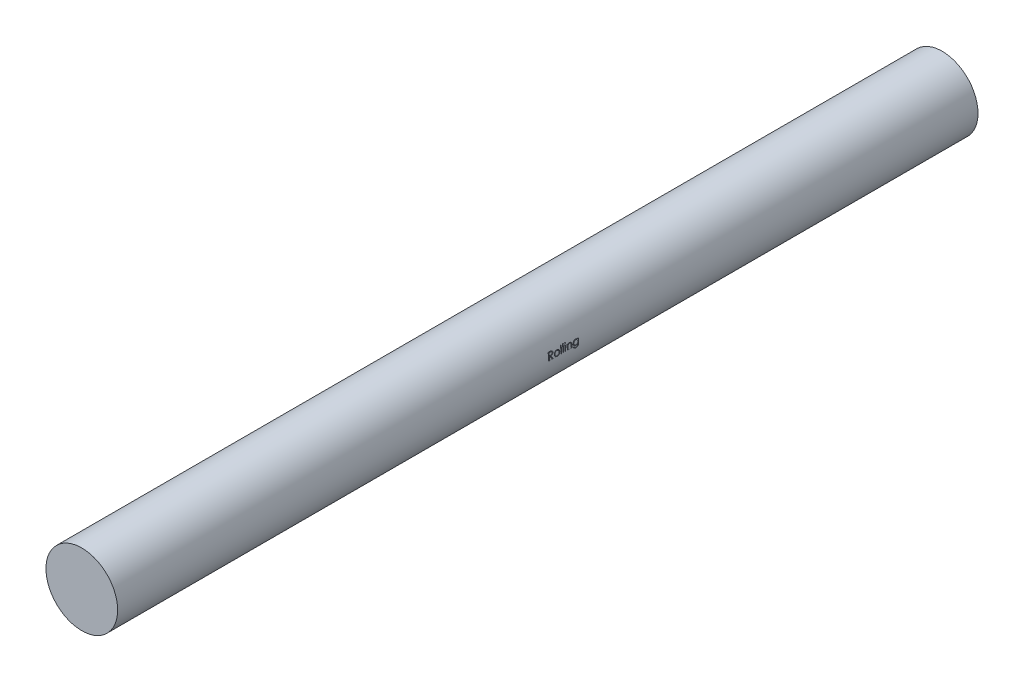
from build123d import *
from build123d.topology import SkipClean

# Parameters (mm, degrees)
SKETCH1_R               = 50
BOSS_EXTRUDE1_DEPTH     = 600
CUT_EXTRUDE1_DEPTH      = 605.15229868
CUT_EXTRUDE1_DEPTH_BACK = 605.15229868
SKETCH3_W               = 0.897435897
SKETCH3_H               = 10.256410256
SKETCH3_H_2             = 7.307692308


with BuildPart() as part:
    # Sketch1 → Boss-Extrude1 (new, symmetric)
    with BuildSketch(Plane.XY):
        Circle(SKETCH1_R)
    extrude(amount=BOSS_EXTRUDE1_DEPTH, both=True)

    # Sketch3 → Cut-Extrude1 (cut, two sides: drawn at the far end of the back side and taken through both)
    # profile 1 of 8: a face of its own
    with SkipClean():  # the faces are left unmerged after this step: merging them gives an invalid solid
        with BuildSketch(Plane(origin=(0, 0, 0), x_dir=(0, 0, -1), z_dir=(1, 0, 0)).offset(-CUT_EXTRUDE1_DEPTH_BACK)):
            with BuildLine():
                Line((1.282051282, 10), (3.283253205, 10))
                add(Edge.make_bspline(
                    [(3.283253205, 10), (3.416799287, 9.999555469), (3.673222556, 9.998701919), (4.040574757, 9.993942596), (4.374366463, 9.98030158), (4.674423147, 9.96856277), (4.940739304, 9.947157224), (5.174131563, 9.926698232), (5.373524985, 9.899916344), (5.494227417, 9.875043707), (5.548878205, 9.863782051)],
                    knots=[0, 0, 0, 0, 1.410062039, 2.707475311, 3.878576406, 4.937260626, 5.877586885, 6.699081471, 7.410979367, 8, 8, 8, 8], degree=3))
                add(Edge.make_bspline(
                    [(5.548878205, 9.863782051), (5.622039988, 9.845705579), (5.766802815, 9.809938254), (5.975231576, 9.734339395), (6.17384393, 9.646854753), (6.361814856, 9.544101266), (6.538202831, 9.425316181), (6.704826576, 9.292550117), (6.862442186, 9.146529529), (7.004675415, 8.983572839), (7.138786991, 8.812611383), (7.251897353, 8.627743506), (7.349401581, 8.434424856), (7.427031629, 8.230689377), (7.489540125, 8.018512886), (7.533615094, 7.795973467), (7.560047059, 7.564084967), (7.562738075, 7.405919513), (7.564102564, 7.325721154)],
                    knots=[0, 0, 0, 0, 1.027469482, 2.033020251, 3.019912614, 3.986113645, 4.951240523, 5.91722682, 6.890402269, 7.87763091, 8.8651537, 9.85103654, 10.82876324, 11.815024772, 12.821070561, 13.842952187, 14.906261191, 16, 16, 16, 16], degree=3))
                add(Edge.make_bspline(
                    [(7.564102564, 7.325721154), (7.559905427, 7.192477998), (7.551715724, 6.93248609), (7.475358285, 6.555169286), (7.350282515, 6.203199815), (7.17793026, 5.87702085), (6.958446044, 5.582990434), (6.694660927, 5.324731991), (6.386427751, 5.108617955), (6.099486848, 4.958752798), (5.846017706, 4.862773059), (5.637351098, 4.795240606), (5.409731163, 4.743063562), (5.165338778, 4.696320328), (4.903156905, 4.661029773), (4.623813935, 4.63518236), (4.327110645, 4.619027935), (4.123284733, 4.616622207), (4.018429487, 4.615384615)],
                    knots=[0, 0, 0, 0, 1.260483769, 2.459530307, 3.627416485, 4.787058657, 5.939039949, 7.08810263, 8.267026773, 9.491475466, 10.141966685, 10.831826277, 11.566392101, 12.351337768, 13.187381173, 14.07005841, 15.007169909, 16, 16, 16, 16], degree=3))
                Line((4.018429487, 4.615384615), (7.692307692, 0))
                Line((7.692307692, 0), (6.582532051, 0))
                Line((6.582532051, 0), (2.908653846, 4.615384615))
                Line((2.908653846, 4.615384615), (2.179487179, 4.615384615))
                Line((2.179487179, 4.615384615), (2.179487179, 0))
                Line((2.179487179, 0), (1.282051282, 0))
                Line((1.282051282, 0), (1.282051282, 10))
            make_face()
            with BuildLine():
                Line((2.179487179, 8.974358974), (2.179487179, 5.641025641))
                Line((2.179487179, 5.641025641), (4.010416667, 5.627003205))
                add(Edge.make_bspline(
                    [(4.010416667, 5.627003205), (4.095902492, 5.626965386), (4.26159837, 5.626892082), (4.501314555, 5.638302871), (4.724514874, 5.651283781), (4.930345594, 5.671139054), (5.118898667, 5.69672783), (5.290079847, 5.728736356), (5.444168567, 5.766027964), (5.623878677, 5.823746895), (5.824554481, 5.915192661), (6.042644366, 6.048236943), (6.228365331, 6.215577284), (6.385273509, 6.406930015), (6.511357599, 6.617319298), (6.600249183, 6.84422321), (6.656656161, 7.08191349), (6.663309148, 7.245279512), (6.666666667, 7.327724359)],
                    knots=[0, 0, 0, 0, 1.146690395, 2.22261258, 3.21895312, 4.145990853, 4.996080663, 5.770904154, 6.481378293, 7.121626537, 8.300444488, 9.431385265, 10.535395872, 11.636531494, 12.74115979, 13.810798291, 14.895190096, 16, 16, 16, 16], degree=3))
                add(Edge.make_bspline(
                    [(6.666666667, 7.327724359), (6.663232035, 7.408143141), (6.656425848, 7.567503823), (6.600857938, 7.800806424), (6.506888277, 8.02099771), (6.380253312, 8.227181953), (6.225970012, 8.414341198), (6.045061976, 8.574475921), (5.842475704, 8.706617249), (5.653129423, 8.791058336), (5.483888816, 8.842829345), (5.33694693, 8.879261242), (5.170914136, 8.908531153), (4.984984254, 8.931982755), (4.779951024, 8.952139739), (4.554777735, 8.96571625), (4.310958363, 8.973755861), (4.141967131, 8.974153258), (4.054487179, 8.974358974)],
                    knots=[0, 0, 0, 0, 1.101028733, 2.181837193, 3.264309656, 4.369019818, 5.486613113, 6.575447106, 7.666700264, 8.788928104, 9.402425223, 10.0903467, 10.862060571, 11.710948788, 12.657782767, 13.684531032, 14.801375019, 16, 16, 16, 16], degree=3))
                Line((4.054487179, 8.974358974), (2.179487179, 8.974358974))
            make_face(mode=Mode.SUBTRACT)
        # profile 2 of 8: a face of its own
        with BuildSketch(Plane(origin=(0, 0, 0), x_dir=(0, 0, -1), z_dir=(1, 0, 0)).offset(-CUT_EXTRUDE1_DEPTH_BACK)):
            with BuildLine():
                add(Edge.make_bspline(
                    [(13.016826923, 7.435897436), (13.153944845, 7.432977747), (13.422799581, 7.42725295), (13.816536398, 7.366067334), (14.192379644, 7.272503436), (14.551768764, 7.143156116), (14.890101037, 6.969779114), (15.212304592, 6.762895425), (15.517496045, 6.517802301), (15.700418986, 6.32820782), (15.793269231, 6.231971154)],
                    knots=[0, 0, 0, 0, 1.054011418, 2.066658804, 3.057071809, 4.030435133, 4.997543892, 5.974964718, 6.972108034, 8, 8, 8, 8], degree=3))
                add(Edge.make_bspline(
                    [(15.793269231, 6.231971154), (15.873217671, 6.139931194), (16.031567329, 5.957632502), (16.23461224, 5.662045037), (16.409530983, 5.355930464), (16.549710871, 5.035223816), (16.660239511, 4.702724756), (16.738712928, 4.357290438), (16.785389885, 3.999683732), (16.791684077, 3.756815623), (16.794871795, 3.633814103)],
                    knots=[0, 0, 0, 0, 1.025258237, 2.030674902, 3.01204498, 3.988269485, 4.97094183, 5.956517959, 6.965070386, 8, 8, 8, 8], degree=3))
                add(Edge.make_bspline(
                    [(16.794871795, 3.633814103), (16.792067974, 3.510099652), (16.786527493, 3.265634128), (16.734117161, 2.905578797), (16.652599772, 2.556450733), (16.535937378, 2.219711608), (16.38634278, 1.894332101), (16.203797958, 1.581733388), (15.987021909, 1.281298722), (15.741296204, 0.995579184), (15.469719415, 0.732247142), (15.175101848, 0.5027378), (14.863233181, 0.306104874), (14.529966457, 0.147715115), (14.178345066, 0.022830257), (13.807610586, -0.064884076), (13.418338956, -0.117917458), (13.152546895, -0.124727668), (13.016826923, -0.128205128)],
                    knots=[0, 0, 0, 0, 0.998656419, 1.973391657, 2.932242238, 3.890759089, 4.846373663, 5.82037756, 6.809684879, 7.83454468, 8.860553229, 9.859544525, 10.845671541, 11.83227036, 12.833544569, 13.85385346, 14.904124723, 16, 16, 16, 16], degree=3))
                add(Edge.make_bspline(
                    [(13.016826923, -0.128205128), (12.88044201, -0.124715996), (12.613325268, -0.117882355), (12.222679605, -0.065090118), (11.851280694, 0.022789832), (11.499198984, 0.148125525), (11.164499421, 0.306109936), (10.850823716, 0.502143335), (10.555966814, 0.732315207), (10.284332573, 0.995560741), (10.038622272, 1.281303474), (9.821842248, 1.581732155), (9.639298459, 1.894332422), (9.489703591, 2.219711522), (9.373041269, 2.556450756), (9.291523861, 2.905578791), (9.239113534, 3.26563413), (9.233573052, 3.510099653), (9.230769231, 3.633814103)],
                    knots=[0, 0, 0, 0, 1.099876186, 2.154163076, 3.173186993, 4.173200201, 5.163417411, 6.152872554, 7.150605724, 8.17532212, 9.198891216, 10.186952605, 11.159729845, 12.11414092, 13.071450619, 14.029093627, 15.002601286, 16, 16, 16, 16], degree=3))
                add(Edge.make_bspline(
                    [(9.230769231, 3.633814103), (9.233978689, 3.756147091), (9.240332864, 3.998345383), (9.28696289, 4.355279842), (9.365130195, 4.700129525), (9.475791327, 5.031345171), (9.617263301, 5.350646417), (9.789724124, 5.657517363), (9.994840217, 5.951768221), (10.152560079, 6.133831307), (10.232371795, 6.225961538)],
                    knots=[0, 0, 0, 0, 1.031353054, 2.041901799, 3.029428768, 4.008703097, 4.981709435, 5.96992636, 6.972712378, 8, 8, 8, 8], degree=3))
                add(Edge.make_bspline(
                    [(10.232371795, 6.225961538), (10.325082055, 6.323032793), (10.507413095, 6.513940497), (10.814123745, 6.758319137), (11.135534663, 6.96950792), (11.47760588, 7.139439964), (11.83669976, 7.2732643), (12.214469024, 7.366308629), (12.609541926, 7.4270325), (12.879712272, 7.432913008), (13.016826923, 7.435897436)],
                    knots=[0, 0, 0, 0, 1.027980169, 2.021703884, 2.998553061, 3.971491411, 4.943284454, 5.930300938, 6.949603206, 8, 8, 8, 8], degree=3))
            make_face()
            with BuildLine():
                add(Edge.make_bspline(
                    [(13.012820513, 6.538461538), (12.915855909, 6.535705562), (12.724429827, 6.530264755), (12.442659585, 6.48888217), (12.171402002, 6.423317873), (11.910142448, 6.330163426), (11.659761955, 6.209880858), (11.420020805, 6.062142686), (11.190213834, 5.888905667), (10.97483651, 5.690440891), (10.777172761, 5.473643764), (10.604378543, 5.242648453), (10.457449667, 5.001201749), (10.335049213, 4.749052575), (10.243885818, 4.483645678), (10.177677183, 4.207986731), (10.136333639, 3.921514113), (10.130943986, 3.726768346), (10.128205128, 3.627804487)],
                    knots=[0, 0, 0, 0, 1.021534396, 2.016698045, 2.994645724, 3.958388632, 4.93408049, 5.916473867, 6.921342795, 7.962252576, 8.998418191, 10.008913653, 10.997312074, 11.973003931, 12.956656626, 13.948281152, 14.957379055, 16, 16, 16, 16], degree=3))
                add(Edge.make_bspline(
                    [(10.128205128, 3.627804487), (10.132796053, 3.499941552), (10.14190818, 3.246157537), (10.216008855, 2.872411472), (10.339969655, 2.51360618), (10.507361883, 2.171845077), (10.717093936, 1.855638569), (10.964199841, 1.573720042), (11.246027556, 1.330332009), (11.559217557, 1.128386736), (11.897372751, 0.967930291), (12.255247954, 0.854218932), (12.62850708, 0.780299811), (12.883594883, 0.772952741), (13.012820513, 0.769230769)],
                    knots=[0, 0, 0, 0, 1.016792936, 2.018143844, 3.017858371, 4.030088057, 5.03801393, 6.028138512, 7.003788237, 7.991172063, 8.984598303, 9.972568034, 10.972917682, 12, 12, 12, 12], degree=3))
                add(Edge.make_bspline(
                    [(13.012820513, 0.769230769), (13.14203871, 0.772974427), (13.397111841, 0.780364304), (13.769852346, 0.853846646), (14.126749409, 0.968428534), (14.464553373, 1.128206276), (14.777600812, 1.33109889), (15.061455444, 1.572345681), (15.306451476, 1.856385257), (15.515976061, 2.17226391), (15.686109612, 2.513076345), (15.809490188, 2.872477694), (15.883769005, 3.246140671), (15.892857087, 3.499935902), (15.897435897, 3.627804487)],
                    knots=[0, 0, 0, 0, 1.02726834, 2.027799167, 3.010890988, 4.004497153, 4.992059811, 5.971914811, 6.958719428, 7.966827853, 8.981595046, 9.981490638, 10.983022906, 12, 12, 12, 12], degree=3))
                add(Edge.make_bspline(
                    [(15.897435897, 3.627804487), (15.894697983, 3.726768938), (15.889310186, 3.921515868), (15.847953145, 4.207980021), (15.78179446, 4.483670297), (15.690446982, 4.748961735), (15.568578371, 5.001854605), (15.418816105, 5.241939539), (15.246727461, 5.474443957), (15.046678544, 5.689740073), (14.831526036, 5.888983035), (14.601625927, 6.062209862), (14.362240274, 6.209231563), (14.11258718, 6.33119225), (13.85129413, 6.422470366), (13.580416618, 6.489260741), (13.29984859, 6.530089875), (13.109108466, 6.535653136), (13.012820513, 6.538461538)],
                    knots=[0, 0, 0, 0, 1.042956736, 2.052379634, 3.044323526, 4.02829302, 5.004299113, 5.996692471, 7.007513377, 8.048758398, 9.090003419, 10.095195979, 11.07790575, 12.047570684, 13.018257071, 13.989683339, 14.985167495, 16, 16, 16, 16], degree=3))
            make_face(mode=Mode.SUBTRACT)
        # profile 3 of 8: a face of its own
        with BuildSketch(Plane(origin=(0, 0, 0), x_dir=(0, 0, -1), z_dir=(1, 0, 0)).offset(-CUT_EXTRUDE1_DEPTH_BACK)):
            with Locations((18.910256411, 5.128205128)):
                Rectangle(SKETCH3_W, SKETCH3_H)
        # profile 4 of 8: a face of its own
        with BuildSketch(Plane(origin=(0, 0, 0), x_dir=(0, 0, -1), z_dir=(1, 0, 0)).offset(-CUT_EXTRUDE1_DEPTH_BACK)):
            with Locations((21.730769231, 5.128205128)):
                Rectangle(SKETCH3_W, SKETCH3_H)
        # profile 5 of 8: a face of its own
        with BuildSketch(Plane(origin=(0, 0, 0), x_dir=(0, 0, -1), z_dir=(1, 0, 0)).offset(-CUT_EXTRUDE1_DEPTH_BACK)):
            with BuildLine():
                add(Edge.make_bspline(
                    [(24.547275641, 10.384615385), (24.602965115, 10.382032092), (24.7120158, 10.376973509), (24.86971085, 10.333655003), (25.013302314, 10.26022733), (25.140667265, 10.161713956), (25.249958369, 10.045858404), (25.326474685, 9.910827066), (25.375652959, 9.764945241), (25.381591689, 9.663187843), (25.384615385, 9.611378205)],
                    knots=[0, 0, 0, 0, 1.055194115, 2.066272739, 3.074728998, 4.095836921, 5.109056067, 6.073838105, 7.019297344, 8, 8, 8, 8], degree=3))
                add(Edge.make_bspline(
                    [(25.384615385, 9.611378205), (25.381523499, 9.560913482), (25.375411208, 9.461150696), (25.32651267, 9.317797919), (25.249306277, 9.184642823), (25.140737346, 9.069012222), (25.013283743, 8.970553308), (24.869715784, 8.897111197), (24.712014502, 8.853796519), (24.602964676, 8.848737408), (24.547275641, 8.846153846)],
                    knots=[0, 0, 0, 0, 0.96129708, 1.900370562, 2.859976407, 3.87933698, 4.906634145, 5.921202961, 6.938410037, 8, 8, 8, 8], degree=3))
                add(Edge.make_bspline(
                    [(24.547275641, 8.846153846), (24.492223426, 8.848638761), (24.385071483, 8.853475323), (24.229737648, 8.897961088), (24.087370535, 8.97057844), (23.959757185, 9.06836754), (23.853385204, 9.185352961), (23.775961417, 9.317716658), (23.727175812, 9.461171385), (23.721048302, 9.560920432), (23.717948718, 9.611378205)],
                    knots=[0, 0, 0, 0, 1.054934014, 2.053291228, 3.073705704, 4.106921865, 5.123545215, 6.088680038, 7.033164197, 8, 8, 8, 8], degree=3))
                add(Edge.make_bspline(
                    [(23.717948718, 9.611378205), (23.720980394, 9.663180633), (23.726934797, 9.764923869), (23.775997986, 9.910909677), (23.852740294, 10.045142539), (23.959827618, 10.162358252), (24.08735179, 10.260202351), (24.229742491, 10.332805156), (24.385070203, 10.377294697), (24.492222992, 10.382130738), (24.547275641, 10.384615385)],
                    knots=[0, 0, 0, 0, 0.98631895, 1.937192651, 2.907499808, 3.917963147, 4.944918757, 5.95915025, 6.951458133, 8, 8, 8, 8], degree=3))
            make_face()
        # profile 6 of 8: a face of its own
        with BuildSketch(Plane(origin=(0, 0, 0), x_dir=(0, 0, -1), z_dir=(1, 0, 0)).offset(-CUT_EXTRUDE1_DEPTH_BACK)):
            with Locations((24.551282052, 3.653846154)):
                Rectangle(SKETCH3_W, SKETCH3_H_2)
        # profile 7 of 8: a face of its own
        with BuildSketch(Plane(origin=(0, 0, 0), x_dir=(0, 0, -1), z_dir=(1, 0, 0)).offset(-CUT_EXTRUDE1_DEPTH_BACK)):
            with BuildLine():
                Line((27.179487179, 7.307692308), (28.076923077, 7.307692308))
                Line((28.076923077, 7.307692308), (28.076923077, 5.989583333))
                add(Edge.make_bspline(
                    [(28.076923077, 5.989583333), (28.172744892, 6.10913397), (28.358690466, 6.341126151), (28.66835999, 6.646042079), (28.995628276, 6.89731415), (29.338491143, 7.097610704), (29.697414029, 7.248601065), (30.070209086, 7.357646582), (30.459108247, 7.423031807), (30.723578066, 7.431575322), (30.857371795, 7.435897436)],
                    knots=[0, 0, 0, 0, 1.12780773, 2.188550248, 3.19190651, 4.159438251, 5.104880172, 6.052711206, 7.014878035, 8, 8, 8, 8], degree=3))
                add(Edge.make_bspline(
                    [(30.857371795, 7.435897436), (30.992602178, 7.430911163), (31.257280657, 7.421151825), (31.642646547, 7.343961279), (32.002570529, 7.212117693), (32.33576926, 7.031511777), (32.636132727, 6.806921853), (32.899918017, 6.545271048), (33.118098723, 6.24431081), (33.264376903, 5.965101793), (33.360735897, 5.717419523), (33.421399718, 5.505285952), (33.472916808, 5.268948377), (33.517578945, 5.009120979), (33.547799265, 4.723983293), (33.571634384, 4.414704173), (33.588716367, 4.0813838), (33.589394101, 3.850850579), (33.58974359, 3.731971154)],
                    knots=[0, 0, 0, 0, 1.235846778, 2.418850247, 3.575807741, 4.728682307, 5.871620074, 6.994088408, 8.11269785, 9.256955736, 9.865816715, 10.540099792, 11.271859618, 12.076849838, 12.949306005, 13.892391288, 14.913166135, 16, 16, 16, 16], degree=3))
                Line((33.58974359, 3.731971154), (33.58974359, 0))
                Line((33.58974359, 0), (32.692307692, 0))
                Line((32.692307692, 0), (32.692307692, 3.4375))
                add(Edge.make_bspline(
                    [(32.692307692, 3.4375), (32.691755669, 3.5369927), (32.690699744, 3.727305302), (32.687369324, 3.999788225), (32.679341306, 4.246892735), (32.668060412, 4.468028071), (32.651548896, 4.662981889), (32.634341378, 4.832151251), (32.613298587, 4.975321373), (32.594547406, 5.061507322), (32.586137821, 5.100160256)],
                    knots=[0, 0, 0, 0, 1.430800155, 2.736877192, 3.918605307, 4.986035426, 5.920637409, 6.731861385, 7.431261377, 8, 8, 8, 8], degree=3))
                add(Edge.make_bspline(
                    [(32.586137821, 5.100160256), (32.555779159, 5.213620785), (32.497348129, 5.431997198), (32.35296532, 5.728209634), (32.170639089, 5.980204456), (31.948073805, 6.186423661), (31.687419303, 6.346911766), (31.389398895, 6.458265922), (31.056888493, 6.527912406), (30.823018828, 6.534847069), (30.701121795, 6.538461538)],
                    knots=[0, 0, 0, 0, 1.084156227, 2.086665306, 3.027808233, 3.945421172, 4.874247719, 5.839848303, 6.874090471, 8, 8, 8, 8], degree=3))
                add(Edge.make_bspline(
                    [(30.701121795, 6.538461538), (30.628928413, 6.537101525), (30.486059576, 6.534410094), (30.274202513, 6.507406385), (30.068704876, 6.463239369), (29.867504279, 6.403614691), (29.674624868, 6.321722493), (29.48386975, 6.228781435), (29.302421853, 6.112929401), (29.126412147, 5.98381334), (28.962661268, 5.840729891), (28.810294587, 5.689745576), (28.674471672, 5.528958136), (28.551418314, 5.360958286), (28.445194704, 5.183438749), (28.352471595, 4.998112159), (28.273798181, 4.804734591), (28.234704774, 4.67052013), (28.215144231, 4.603365385)],
                    knots=[0, 0, 0, 0, 1.023777757, 2.026029729, 3.023749952, 4.003683103, 4.997618607, 5.993177895, 7.010360494, 8.046726602, 9.087585522, 10.09234134, 11.086953743, 12.070360549, 13.043493632, 14.017870808, 15.008233677, 16, 16, 16, 16], degree=3))
                add(Edge.make_bspline(
                    [(28.215144231, 4.603365385), (28.203888092, 4.554064804), (28.179384067, 4.44674002), (28.152917838, 4.270613108), (28.128896194, 4.066870322), (28.108790598, 3.835749416), (28.096489409, 3.576441202), (28.083076846, 3.290053094), (28.078193815, 2.975443127), (28.077358518, 2.756409719), (28.076923077, 2.642227564)],
                    knots=[0, 0, 0, 0, 0.615963638, 1.340920617, 2.168419149, 3.115676021, 4.16674242, 5.331190069, 6.6087489, 8, 8, 8, 8], degree=3))
                Line((28.076923077, 2.642227564), (28.076923077, 0))
                Line((28.076923077, 0), (27.179487179, 0))
                Line((27.179487179, 0), (27.179487179, 7.307692308))
            make_face()
        # profile 8 of 8: a face of its own
        with BuildSketch(Plane(origin=(0, 0, 0), x_dir=(0, 0, -1), z_dir=(1, 0, 0)).offset(-CUT_EXTRUDE1_DEPTH_BACK)):
            with BuildLine():
                Line((42.051282051, 7.307692308), (42.948717949, 7.307692308))
                Line((42.948717949, 7.307692308), (42.948717949, 1.508413462))
                add(Edge.make_bspline(
                    [(42.948717949, 1.508413462), (42.947926399, 1.384877477), (42.946398516, 1.146423269), (42.935395741, 0.801628185), (42.912193806, 0.483153655), (42.885883288, 0.189547201), (42.848035527, -0.077830256), (42.801817335, -0.319776555), (42.749715394, -0.536523876), (42.703943345, -0.670023422), (42.682291667, -0.733173077)],
                    knots=[0, 0, 0, 0, 1.307562039, 2.523909702, 3.650326591, 4.686913197, 5.643429486, 6.506965704, 7.293745905, 8, 8, 8, 8], degree=3))
                add(Edge.make_bspline(
                    [(42.682291667, -0.733173077), (42.650322413, -0.815258567), (42.587339766, -0.976975244), (42.469380813, -1.206216161), (42.337283946, -1.422062989), (42.186407516, -1.62331285), (42.01743379, -1.808955457), (41.834343812, -1.983024026), (41.633571837, -2.141835933), (41.415232659, -2.282651069), (41.184359421, -2.409471223), (40.941084844, -2.519318558), (40.686780734, -2.614995254), (40.419058187, -2.686660385), (40.14211466, -2.748759586), (39.852693428, -2.789172974), (39.552485437, -2.816678855), (39.34835578, -2.819222378), (39.244791667, -2.820512821)],
                    knots=[0, 0, 0, 0, 0.981931301, 1.934503488, 2.87077864, 3.801706999, 4.735015492, 5.667491629, 6.616593066, 7.585388521, 8.561939025, 9.551802639, 10.560317337, 11.588439944, 12.640189604, 13.723962949, 14.845264515, 16, 16, 16, 16], degree=3))
                add(Edge.make_bspline(
                    [(39.244791667, -2.820512821), (39.093692425, -2.818065718), (38.79855501, -2.81328587), (38.368255031, -2.757597541), (37.959584403, -2.678870761), (37.577943098, -2.559712396), (37.225742821, -2.413892426), (36.905388891, -2.246478274), (36.619757155, -2.054508821), (36.362260946, -1.835935675), (36.129856403, -1.576039442), (35.911207003, -1.26975703), (35.700747169, -0.912423061), (35.577408204, -0.650158166), (35.512820513, -0.512820513)],
                    knots=[0, 0, 0, 0, 1.157897085, 2.2616841, 3.32207898, 4.345638746, 5.321241055, 6.241986252, 7.112515963, 7.955008012, 8.825025602, 9.77857164, 10.836726669, 12, 12, 12, 12], degree=3))
                Line((35.512820513, -0.512820513), (36.41025641, -0.512820513))
                add(Edge.make_bspline(
                    [(36.41025641, -0.512820513), (36.482434151, -0.627408729), (36.623532747, -0.851414582), (36.887385549, -1.141452171), (37.176546482, -1.389318927), (37.500774148, -1.589063996), (37.861417621, -1.7396634), (38.258693867, -1.847021389), (38.695835643, -1.911296438), (39.000173398, -1.919042992), (39.158653846, -1.923076923)],
                    knots=[0, 0, 0, 0, 0.997731894, 1.950442991, 2.880492273, 3.800895997, 4.748200782, 5.754801363, 6.83083817, 8, 8, 8, 8], degree=3))
                add(Edge.make_bspline(
                    [(39.158653846, -1.923076923), (39.315130676, -1.918990784), (39.61680234, -1.911113116), (40.050605681, -1.846992704), (40.446591218, -1.739640036), (40.802477505, -1.589330361), (41.114065416, -1.405186342), (41.382671105, -1.199471844), (41.600227322, -0.967526121), (41.746550084, -0.753863818), (41.837506135, -0.563509162), (41.895426811, -0.399644602), (41.942495295, -0.214350666), (41.98186626, -0.008248562), (42.014354584, 0.218956172), (42.034934247, 0.467783039), (42.049807995, 0.737666531), (42.050779337, 0.924789783), (42.051282051, 1.021634615)],
                    knots=[0, 0, 0, 0, 1.570740765, 3.028230971, 4.391408896, 5.680370741, 6.894727393, 8.017376726, 9.065722033, 10.075533815, 10.603371122, 11.180248986, 11.817768598, 12.521299649, 13.286540596, 14.121245857, 15.027658897, 16, 16, 16, 16], degree=3))
                Line((42.051282051, 1.021634615), (42.051282051, 1.400240385))
                add(Edge.make_bspline(
                    [(42.051282051, 1.400240385), (41.960193144, 1.291835236), (41.779617557, 1.076931751), (41.467768051, 0.795327075), (41.127148292, 0.552795274), (40.75833817, 0.353884889), (40.370371764, 0.194795105), (39.967451106, 0.083529502), (39.553188091, 0.011644074), (39.272467663, 0.003908885), (39.130608974, 0)],
                    knots=[0, 0, 0, 0, 1.012485704, 2.007162095, 2.997754123, 3.998611389, 4.999708251, 5.992315798, 6.98544096, 8, 8, 8, 8], degree=3))
                add(Edge.make_bspline(
                    [(39.130608974, 0), (39.047076776, 0.001471504), (38.881000897, 0.004397099), (38.634273048, 0.029993606), (38.391186081, 0.067132869), (38.152306928, 0.121651267), (37.917290891, 0.191627628), (37.686526342, 0.279104025), (37.458144837, 0.378004362), (37.236297701, 0.494498087), (37.02319447, 0.624104678), (36.820442512, 0.764501508), (36.629103829, 0.91495376), (36.450999574, 1.076945017), (36.28636337, 1.250240825), (36.13298089, 1.432993833), (35.993388469, 1.627755952), (35.864721643, 1.83097583), (35.753128642, 2.044007041), (35.655173294, 2.262230171), (35.570003565, 2.485178612), (35.502102417, 2.713598791), (35.450242094, 2.947346702), (35.411641445, 3.186039413), (35.389747355, 3.43041195), (35.386333286, 3.595044376), (35.384615385, 3.677884615)],
                    knots=[0, 0, 0, 0, 1.028754217, 2.045334182, 3.052854819, 4.056607503, 5.061168794, 6.071104265, 7.095078842, 8.125279047, 9.155117945, 10.165957491, 11.161587969, 12.151493252, 13.128948131, 14.104219989, 15.088194871, 16.07871515, 17.064853787, 18.047899887, 19.02414258, 20.002704429, 20.980574569, 21.971845993, 22.979467364, 24, 24, 24, 24], degree=3))
                add(Edge.make_bspline(
                    [(35.384615385, 3.677884615), (35.386098717, 3.760750604), (35.389059636, 3.926161629), (35.414633863, 4.171531302), (35.451114404, 4.413615402), (35.508850887, 4.649918664), (35.578343808, 4.883132241), (35.664411159, 5.111533545), (35.767893328, 5.335192142), (35.885064041, 5.554273661), (36.016732878, 5.765838275), (36.161111394, 5.966771549), (36.318373892, 6.155594897), (36.486350794, 6.334213245), (36.667093128, 6.500903226), (36.860507392, 6.655260268), (37.06468705, 6.799871772), (37.280264907, 6.93161845), (37.503914588, 7.048139154), (37.729954068, 7.15446086), (37.961377597, 7.238844058), (38.193870566, 7.31319577), (38.431527466, 7.365867756), (38.671434305, 7.406502733), (38.914412412, 7.431259079), (39.07713497, 7.434349322), (39.158653846, 7.435897436)],
                    knots=[0, 0, 0, 0, 1.008818848, 2.013730394, 3.001654427, 3.987803273, 4.973046549, 5.963777569, 6.957074694, 7.972068341, 8.987420212, 9.989399531, 10.982630087, 11.977756091, 12.973280677, 13.973972381, 14.989194003, 16.018387222, 17.047741039, 18.059210846, 19.057554164, 20.045176975, 21.029480261, 22.018708529, 23.007435371, 24, 24, 24, 24], degree=3))
                add(Edge.make_bspline(
                    [(39.158653846, 7.435897436), (39.2930851, 7.432021227), (39.558545521, 7.424366904), (39.949205528, 7.364306489), (40.326183357, 7.268552165), (40.691606259, 7.131364649), (41.048450976, 6.944078825), (41.39554142, 6.697384688), (41.733881803, 6.389069432), (41.942675604, 6.152632676), (42.051282051, 6.029647436)],
                    knots=[0, 0, 0, 0, 0.96728863, 1.910097829, 2.838038873, 3.762875196, 4.71315279, 5.730631239, 6.819562287, 8, 8, 8, 8], degree=3))
                Line((42.051282051, 6.029647436), (42.051282051, 7.307692308))
            make_face()
            with BuildLine():
                add(Edge.make_bspline(
                    [(39.230769231, 6.538461538), (39.099538648, 6.534001351), (38.839729921, 6.525171127), (38.458906086, 6.449786232), (38.091257704, 6.331655089), (37.743813624, 6.162676188), (37.418364738, 5.956692651), (37.129579537, 5.707148972), (36.876994063, 5.422159838), (36.663328525, 5.104301989), (36.493238906, 4.761381202), (36.372829136, 4.399921962), (36.294971927, 4.02576484), (36.286378635, 3.770414545), (36.282051282, 3.641826923)],
                    knots=[0, 0, 0, 0, 1.026226791, 2.031711442, 3.026614839, 4.04107745, 5.047145931, 6.032893242, 7.017642609, 8.019221815, 9.021877557, 10.003543541, 10.994637589, 12, 12, 12, 12], degree=3))
                add(Edge.make_bspline(
                    [(36.282051282, 3.641826923), (36.284124873, 3.544874716), (36.28820302, 3.354198076), (36.327413242, 3.074375519), (36.390787428, 2.807860338), (36.480608018, 2.554636411), (36.591901432, 2.313251282), (36.731879634, 2.085367755), (36.896596696, 1.87078288), (37.084763376, 1.671083789), (37.292124467, 1.489195308), (37.517036465, 1.329372335), (37.759194322, 1.198655989), (38.012642351, 1.085682168), (38.283530225, 1.003170545), (38.567956185, 0.940202605), (38.867932461, 0.904177583), (39.072423145, 0.899712447), (39.176682692, 0.897435897)],
                    knots=[0, 0, 0, 0, 1.039728707, 2.044842319, 3.024901384, 3.974314358, 4.923051295, 5.871625912, 6.837440708, 7.820715446, 8.810779094, 9.792721783, 10.773906224, 11.758876063, 12.764959493, 13.806266761, 14.881525401, 16, 16, 16, 16], degree=3))
                add(Edge.make_bspline(
                    [(39.176682692, 0.897435897), (39.28229343, 0.899629066), (39.488814108, 0.903917784), (39.790445355, 0.940784923), (40.076253185, 1.000276284), (40.345975535, 1.08474207), (40.600630795, 1.192518501), (40.837358265, 1.328908837), (41.061233831, 1.484235785), (41.265109287, 1.665412969), (41.449464046, 1.865084383), (41.61012338, 2.082355512), (41.747021805, 2.313956995), (41.860386576, 2.559862725), (41.946932874, 2.821983734), (42.004986888, 3.09966475), (42.045577589, 3.391575433), (42.049351659, 3.59160005), (42.051282051, 3.693910256)],
                    knots=[0, 0, 0, 0, 1.121943988, 2.193949579, 3.223793937, 4.220241907, 5.192961521, 6.155822191, 7.11847367, 8.083710714, 9.04790392, 10.001595906, 10.949595423, 11.902125208, 12.873731292, 13.87582262, 14.913508608, 16, 16, 16, 16], degree=3))
                add(Edge.make_bspline(
                    [(42.051282051, 3.693910256), (42.047454714, 3.827104125), (42.039977441, 4.087318139), (41.969414133, 4.466480333), (41.855642104, 4.822962258), (41.696079955, 5.155636475), (41.496131359, 5.460978046), (41.255300362, 5.733331887), (40.977740274, 5.97304862), (40.66424856, 6.172757745), (40.326970145, 6.334087557), (39.974052442, 6.455121192), (39.606019402, 6.523676378), (39.356572518, 6.533504787), (39.230769231, 6.538461538)],
                    knots=[0, 0, 0, 0, 1.070913519, 2.092188694, 3.091357305, 4.074328408, 5.051968682, 6.018948707, 6.99050112, 7.9935919, 9.000589572, 9.992915277, 10.987769056, 12, 12, 12, 12], degree=3))
            make_face(mode=Mode.SUBTRACT)
        extrude(amount=CUT_EXTRUDE1_DEPTH + CUT_EXTRUDE1_DEPTH_BACK, mode=Mode.SUBTRACT)


with BuildPart() as cut_extrude1_piece_1:
    # of the separate pieces the step leaves, piece 1, a body of its own (cut_extrude1_pieces)
    add(part.part.solids().sort_by_distance((50, 0, -600))[0])


with BuildPart() as cut_extrude1_piece_2:
    # of the separate pieces the step leaves, piece 2, a body of its own (cut_extrude1_pieces)
    add(part.part.solids().sort_by_distance((49.570641722, 6.538461538, -13.012820513))[0])


with BuildPart() as cut_extrude1_piece_3:
    # of the separate pieces the step leaves, piece 3, a body of its own (cut_extrude1_pieces)
    add(part.part.solids().sort_by_distance((49.570641722, 6.538461538, -39.230769231))[0])


with BuildPart() as cut_extrude1_piece_4:
    # of the separate pieces the step leaves, piece 4, a body of its own (cut_extrude1_pieces)
    add(part.part.solids().sort_by_distance((49.188015624, 8.974358974, -4.054487179))[0])


solid = Compound([cut_extrude1_piece_1.part, cut_extrude1_piece_2.part, cut_extrude1_piece_3.part, cut_extrude1_piece_4.part])
